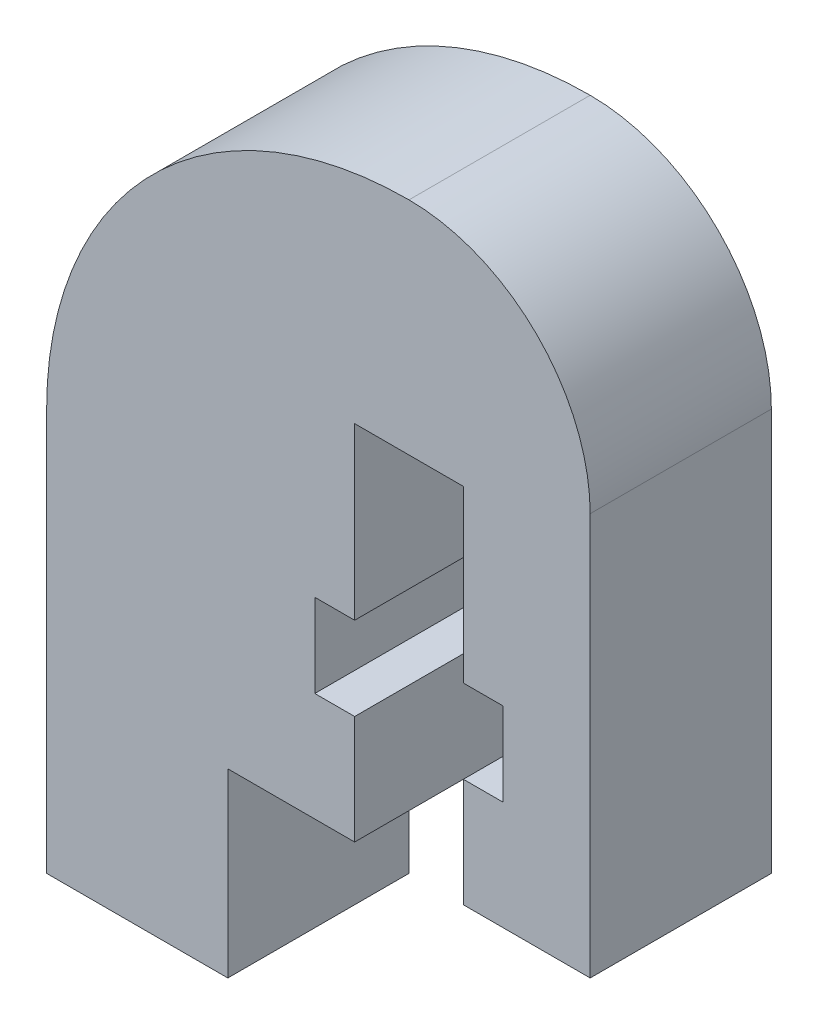
from build123d import *

# Parameters (mm, degrees)
BOSS_EXTRUDE1_DEPTH = 5
FILLET1_R           = 10
FILLET2_R           = 5


with BuildPart() as part:
    # Sketch1 → Boss-Extrude1 (new body)
    with BuildSketch(Plane.XY):
        Polygon((-18.484799863, 5), (-21.984799863, 5), (-21.984799863, 0), (-26.984799863, 0), (-26.984799863, 5), (-26.984799863, 21.097384909), (-11.984799863, 21.097384909), (-11.984799863, 5), (-15.484799863, 5), (-15.484799863, 8), (-14.384799863, 8), (-14.384799863, 10.3), (-15.484799863, 10.3), (-15.484799863, 15), (-18.484799863, 15), (-18.484799863, 10.3), (-19.584799863, 10.3), (-19.584799863, 8), (-18.484799863, 8), align=None)
    extrude(amount=BOSS_EXTRUDE1_DEPTH)

    # Fillet1
    fillet1_edges = [part.edges().sort_by_distance(p)[0] for p in [
        (-26.984799863, 21.097384909, 2.5),
    ]]
    fillet(fillet1_edges, radius=FILLET1_R)

    # Fillet2
    fillet2_edges = [part.edges().sort_by_distance(p)[0] for p in [
        (-11.984799863, 21.097384909, 2.5),
    ]]
    fillet(fillet2_edges, radius=FILLET2_R - 0.0001)  # a hair under: the kernel refuses the full size


solid = part.part
